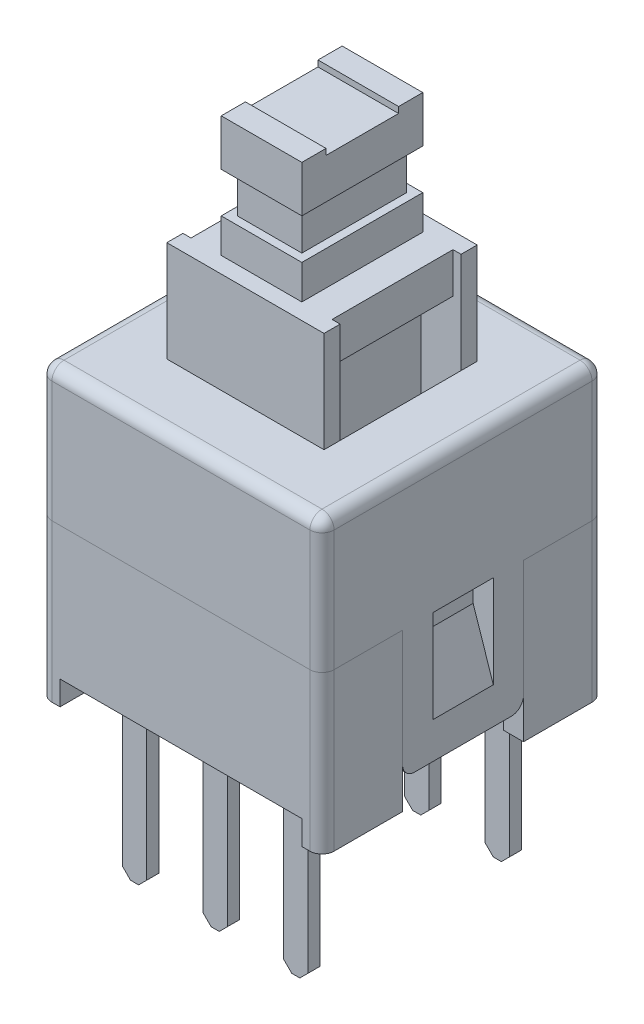
from build123d import *

# Parameters (mm, degrees)
BOSS_EXTRUDE1_DEPTH        = 3.3
SKETCH2_W                  = 0.5
SKETCH2_H                  = 2
BOSS_EXTRUDE2_DEPTH        = 0.6
BOSS_EXTRUDE3_DEPTH        = 0.75
CUT_EXTRUDE1_DEPTH         = 0.25
FILLET1_R                  = 0.3
SKETCH7_W                  = 3.9
SKETCH7_H                  = 3.8
BOSS_EXTRUDE6_DEPTH        = 3.3
FILLET2_R                  = 0.3
BOSS_EXTRUDE7_DEPTH        = 0.5
BOSS_EXTRUDE8_DEPTH        = 0.5
SKETCH5_W                  = 1
SKETCH5_H                  = 0.3
BOSS_EXTRUDE4_DEPTH        = 0.6
SKETCH6_W                  = 0.6
SKETCH6_H                  = 0.3
BOSS_EXTRUDE5_DEPTH        = 3.7
CHAMFER1_SIZE              = 0.2
LPATTERN1_COUNT            = 2
LPATTERN1_PITCH            = 2
CHAMFER1_OF_LPATTERN1_SIZE = 0.2
MIRROR1_START              = -2.65
MIRROR1_DEPTH              = 0.3
MIRROR2_START              = 2.35
MIRROR2_DEPTH              = 0.3
BOSS_EXTRUDE9_DEPTH        = 4.8
BOSS_EXTRUDE10_DEPTH       = 1
SKETCH12_W                 = 2
SKETCH12_H                 = 3
BOSS_EXTRUDE11_DEPTH       = 0.85
SKETCH13_W                 = 1.6
SKETCH13_H                 = 2.6
BOSS_EXTRUDE12_DEPTH       = 1
SKETCH14_W                 = 2
SKETCH14_H                 = 3
BOSS_EXTRUDE13_DEPTH       = 1
SKETCH15_W                 = 2
SKETCH15_H                 = 0.6
BOSS_EXTRUDE14_DEPTH       = 0.15


# Read off the part's stored shape, not the designer's step: Mirror1, Mirror2
with BuildPart() as part:
    # Sketch1 → Boss-Extrude1 (new body)
    with BuildSketch(Plane(origin=(0, 0, 0), x_dir=(1, 0, 0), z_dir=(0, 1, 0))):
        Polygon((-3.5, -3.5), (3.5, -3.5), (3.5, -1.5), (3, -1.5), (3, 1.5), (3.5, 1.5), (3.5, 3.5), (-3.5, 3.5), (-3.5, 1.5), (-3, 1.5), (-3, -1.5), (-3.5, -1.5), align=None)
    extrude(amount=BOSS_EXTRUDE1_DEPTH)

    # Sketch2 → Boss-Extrude2 (add)
    with BuildSketch(Plane.XZ):
        with Locations((3.25, 2.5)):
            Rectangle(SKETCH2_W, SKETCH2_H)
        with Locations((3.25, -2.5)):
            Rectangle(SKETCH2_W, SKETCH2_H)
        with Locations((-3.25, -2.5)):
            Rectangle(SKETCH2_W, SKETCH2_H)
        with Locations((-3.25, 2.5)):
            Rectangle(SKETCH2_W, SKETCH2_H)
    extrude(amount=BOSS_EXTRUDE2_DEPTH)

    # Sketch3 → Boss-Extrude3 (add, symmetric)
    with BuildSketch(Plane.XY):
        Polygon((3, 2.5), (3.5, 1), (3, 1), align=None)
        Polygon((-3, 1), (-3, 2.5), (-3.5, 1), align=None)
    extrude(amount=BOSS_EXTRUDE3_DEPTH, both=True)

    # Sketch4 → Cut-Extrude1 (cut, symmetric)
    with BuildSketch(Plane.XY):
        Polygon((-3.5, 1), (-3, 1), (-3, 2.5), align=None)
    extrude(amount=CUT_EXTRUDE1_DEPTH, both=True, mode=Mode.SUBTRACT)

    # Fillet1
    fillet1_edges = [part.edges().sort_by_distance(p)[0] for p in [
        (3.5, 1.35, 3.5),
        (-3.5, 1.35, 3.5),
        (-3.5, 1.35, -3.5),
        (3.5, 1.35, -3.5),
    ]]
    fillet(fillet1_edges, radius=FILLET1_R)



with BuildPart() as body_2:
    # Sketch7 → Boss-Extrude6 (new body)
    with BuildSketch(Plane(origin=(0, 3.3, 0), x_dir=(1, 0, 0), z_dir=(0, 1, 0))):
        with BuildLine():
            Line((3.2, 3.5), (-3.2, 3.5))
            ThreePointArc((-3.2, 3.5), (-3.412132034, 3.412132034), (-3.5, 3.2))
            Line((-3.5, 3.2), (-3.5, -3.2))
            ThreePointArc((-3.5, -3.2), (-3.412132034, -3.412132034), (-3.2, -3.5))
            Line((-3.2, -3.5), (3.2, -3.5))
            ThreePointArc((3.2, -3.5), (3.412132034, -3.412132034), (3.5, -3.2))
            Line((3.5, -3.2), (3.5, 3.2))
            ThreePointArc((3.5, 3.2), (3.412132034, 3.412132034), (3.2, 3.5))
        make_face()
        Rectangle(SKETCH7_W, SKETCH7_H, mode=Mode.SUBTRACT)
    extrude(amount=BOSS_EXTRUDE6_DEPTH)

    # Fillet2
    fillet2_edges = [body_2.edges().sort_by_distance(p)[0] for p in [
        (-3.412132034, 6.6, -3.412132034),
        (-3.5, 6.6, 0),
        (-3.412132034, 6.6, 3.412132034),
        (0, 6.6, 3.5),
        (3.412132034, 6.6, 3.412132034),
        (3.5, 6.6, 0),
        (3.412132034, 6.6, -3.412132034),
        (0, 6.6, -3.5),
    ]]
    fillet(fillet2_edges, radius=FILLET2_R)

    # Sketch8 → Boss-Extrude7 (add)
    with BuildSketch(Plane(origin=(3.5, 0, 0), x_dir=(0, 0, -1), z_dir=(1, 0, 0))):
        with BuildLine():
            Line((0.75, 1), (0.75, 3.872614331))
            Line((0.75, 3.872614331), (1.5, 3.872614331))
            Line((1.5, 3.872614331), (1.5, 0.4))
            ThreePointArc((1.5, 0.4), (1.412132034, 0.187867966), (1.2, 0.1))
            Line((1.2, 0.1), (-1.2, 0.1))
            ThreePointArc((-1.2, 0.1), (-1.412132034, 0.187867966), (-1.5, 0.4))
            Line((-1.5, 0.4), (-1.5, 3.872614331))
            Line((-1.5, 3.872614331), (-0.75, 3.872614331))
            Line((-0.75, 3.872614331), (-0.75, 1))
            Line((-0.75, 1), (0.75, 1))
        make_face()
    extrude(amount=-BOSS_EXTRUDE7_DEPTH)

    # Sketch9 → Boss-Extrude8 (add)
    with BuildSketch(Plane.ZY.offset(3.5)):
        with BuildLine():
            Line((-0.75, 3.3), (-0.75, 1))
            Line((-0.75, 1), (-0.25, 1))
            Line((-0.25, 1), (-0.25, 3.3))
            Line((-0.25, 3.3), (0.25, 3.3))
            Line((0.25, 3.3), (0.25, 1))
            Line((0.25, 1), (0.75, 1))
            Line((0.75, 1), (0.75, 3.3))
            Line((0.75, 3.3), (1.5, 3.3))
            Line((1.5, 3.3), (1.5, 0.4))
            ThreePointArc((1.5, 0.4), (1.412132034, 0.187867966), (1.2, 0.1))
            Line((1.2, 0.1), (-1.2, 0.1))
            ThreePointArc((-1.2, 0.1), (-1.412132034, 0.187867966), (-1.5, 0.4))
            Line((-1.5, 0.4), (-1.5, 3.3))
            Line((-1.5, 3.3), (-0.75, 3.3))
        make_face()
    extrude(amount=-BOSS_EXTRUDE8_DEPTH)


with BuildPart() as body_3:
    # Sketch5 → Boss-Extrude4 (new body)
    with BuildSketch(Plane.XZ):
        with Locations((0, -2.5)):
            Rectangle(SKETCH5_W, SKETCH5_H)
    boss_extrude4 = extrude(amount=BOSS_EXTRUDE4_DEPTH)


with BuildPart() as part_1:
    add(part.part)

    add(body_3.part)  # Boss-Extrude5 merges body 3
    # Sketch6 → Boss-Extrude5 (add)
    with BuildSketch(Plane.XZ.offset(0.6)):
        with Locations((0, -2.5)):
            Rectangle(SKETCH6_W, SKETCH6_H)
    boss_extrude5 = extrude(amount=BOSS_EXTRUDE5_DEPTH)

    # Chamfer1
    chamfer1_edges = [part_1.edges().sort_by_distance(p)[0] for p in [
        (-0.3, -4.3, -2.5),
        (0.3, -4.3, -2.5),
        (-0.5, -0.6, -2.5),
        (0.5, -0.6, -2.5),
    ]]
    chamfer(chamfer1_edges, length=CHAMFER1_SIZE - 0.0001)  # a hair under: the kernel refuses the full size

    # LPattern1: Boss-Extrude4, Boss-Extrude5 ×2
    with Locations(*[(i * LPATTERN1_PITCH, 0, 0) for i in range(1, LPATTERN1_COUNT)]):
        add(boss_extrude4)
        add(boss_extrude5)

    # Chamfer1 of LPattern1
    chamfer1_of_lpattern1_edges = [part_1.edges().sort_by_distance(p)[0] for p in [
        (1.7, -4.3, -2.5),
        (2.3, -4.3, -2.5),
        (1.5, -0.6, -2.5),
        (2.5, -0.6, -2.5),
    ]]
    chamfer(chamfer1_of_lpattern1_edges, length=CHAMFER1_OF_LPATTERN1_SIZE - 0.0001)  # a hair under: the kernel refuses the full size

    # Mirror1 outline → Mirror1 (add)
    with BuildSketch(Plane.XY.offset(MIRROR1_START)):
        Polygon((-2.3, -4.1), (-2.1, -4.3), (-1.9, -4.3), (-1.7, -4.1), (-1.7, -0.6), (-1.5, -0.4), (-1.5, 0), (-2.5, 0), (-2.5, -0.4), (-2.3, -0.6), align=None)
    extrude(amount=MIRROR1_DEPTH)

    # Mirror2 outline → Mirror2 (add)
    with BuildSketch(Plane.XY.offset(MIRROR2_START)):
        Polygon((0.5, 0), (-0.5, 0), (-0.5, -0.4), (-0.3, -0.6), (-0.3, -4.1), (-0.1, -4.3), (0.1, -4.3), (0.3, -4.1), (0.3, -0.6), (0.5, -0.4), align=None)
        Polygon((-1.5, -0.4), (-1.5, 0), (-2.5, 0), (-2.5, -0.4), (-2.3, -0.6), (-2.3, -4.1), (-2.1, -4.3), (-1.9, -4.3), (-1.7, -4.1), (-1.7, -0.6), align=None)
        Polygon((2.5, 0), (1.5, 0), (1.5, -0.4), (1.7, -0.6), (1.7, -4.1), (1.9, -4.3), (2.1, -4.3), (2.3, -4.1), (2.3, -0.6), (2.5, -0.4), align=None)
    extrude(amount=MIRROR2_DEPTH)


with BuildPart() as body_3_2:
    # Sketch10 → Boss-Extrude9 (new body)
    with BuildSketch(Plane(origin=(0, 3.3, 0), x_dir=(1, 0, 0), z_dir=(0, 1, 0))):
        Polygon((1.95, -1.9), (1.95, -1.5), (0.95, -1.5), (0.95, 1.5), (1.95, 1.5), (1.95, 1.9), (-1.95, 1.9), (-1.95, 1.5), (-0.95, 1.5), (-0.95, -1.5), (-1.95, -1.5), (-1.95, -1.9), align=None)
    extrude(amount=BOSS_EXTRUDE9_DEPTH)

    # Sketch11 → Boss-Extrude10 (add)
    with BuildSketch(Plane(origin=(0, 8.1, 0), x_dir=(1, 0, 0), z_dir=(0, 1, 0))):
        Polygon((1.95, 1.9), (-1.95, 1.9), (-1.95, 1.5), (-1.75, 1.5), (-1.75, -1.5), (-1.95, -1.5), (-1.95, -1.9), (1.95, -1.9), (1.95, -1.5), (1.75, -1.5), (1.75, 1.5), (1.95, 1.5), align=None)
    extrude(amount=BOSS_EXTRUDE10_DEPTH)

    # Sketch12 → Boss-Extrude11 (add)
    with BuildSketch(Plane(origin=(0, 9.1, 0), x_dir=(1, 0, 0), z_dir=(0, 1, 0))):
        Rectangle(SKETCH12_W, SKETCH12_H)
    extrude(amount=BOSS_EXTRUDE11_DEPTH)

    # Sketch13 → Boss-Extrude12 (add)
    with BuildSketch(Plane(origin=(0, 9.95, 0), x_dir=(1, 0, 0), z_dir=(0, 1, 0))):
        Rectangle(SKETCH13_W, SKETCH13_H)
    extrude(amount=BOSS_EXTRUDE12_DEPTH)

    # Sketch14 → Boss-Extrude13 (add)
    with BuildSketch(Plane(origin=(0, 10.95, 0), x_dir=(1, 0, 0), z_dir=(0, 1, 0))):
        Rectangle(SKETCH14_W, SKETCH14_H)
    extrude(amount=BOSS_EXTRUDE13_DEPTH)

    # Sketch15 → Boss-Extrude14 (add)
    with BuildSketch(Plane(origin=(0, 11.95, 0), x_dir=(1, 0, 0), z_dir=(0, 1, 0))):
        with Locations((0, 1.2)):
            Rectangle(SKETCH15_W, SKETCH15_H)
        with Locations((0, -1.2)):
            Rectangle(SKETCH15_W, SKETCH15_H)
    extrude(amount=BOSS_EXTRUDE14_DEPTH)


solid = Compound([body_2.part, part_1.part, body_3_2.part])
